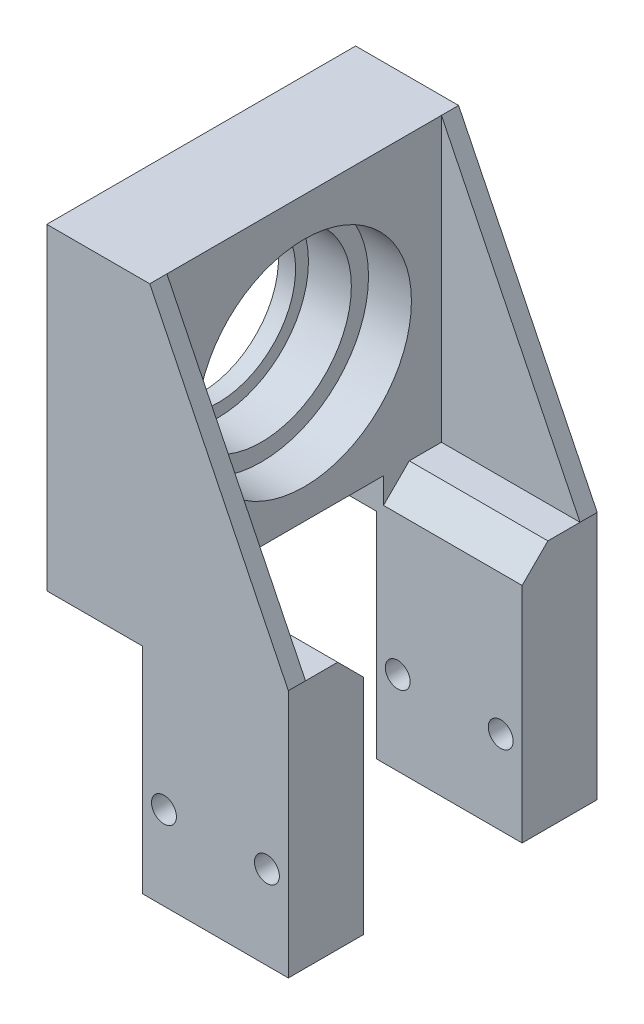
from build123d import *

# Parameters (mm, degrees)
BOSS_EXTRUDE1_DEPTH    = 36
SKETCH2_R              = 10.5
CUT_EXTRUDE1_DEPTH     = 74.491730036
SKETCH3_W              = 18.5
SKETCH3_H              = 29
CUT_EXTRUDE2_DEPTH     = 78.024618067
RIB1_REACH             = 75.682
SKETCH4_WALL_W         = 186.1063102
SKETCH4_WALL_H         = 2
RIB2_REACH             = 75.682
SKETCH5_WALL_W         = 186.1063102
SKETCH5_WALL_H         = 2
CHAMFER1_SIZE          = 3
BOSS_EXTRUDE2_START    = -2
SKETCH6_R              = 10.5
SKETCH6_R_2            = 9
BOSS_EXTRUDE2_DEPTH    = 2
M2_5_CLEARANCE_HOLE1_D = 2.9
SKETCH10_R             = 15
SKETCH10_R_2           = 11
CUT_EXTRUDE4_DEPTH     = 0.6
SKETCH11_R             = 12.5
CUT_EXTRUDE5_DEPTH     = 5


with BuildPart() as part:
    # Sketch1 → Boss-Extrude1 (new body)
    with BuildSketch(Plane.XY):
        Polygon((0, 0), (17, 0), (17, 29), (0.843441467, 29), (0.843441467, 62), (-11.156558533, 62), (-11.156558533, 25), (0, 25), align=None)
    extrude(amount=BOSS_EXTRUDE1_DEPTH)

    # Sketch2 → Cut-Extrude1 (cut, through all)
    with BuildSketch(Plane(origin=(0.843441467, 0, 0), x_dir=(0, 0, -1), z_dir=(1, 0, 0))):
        with Locations((-18, 45)):
            Circle(SKETCH2_R)
    extrude(amount=-CUT_EXTRUDE1_DEPTH, mode=Mode.SUBTRACT)

    # Sketch3 → Cut-Extrude2 (cut, through all)
    with BuildSketch(Plane(origin=(17, 0, 0), x_dir=(0, 0, -1), z_dir=(1, 0, 0))):
        with Locations((-18, 14.5)):
            Rectangle(SKETCH3_W, SKETCH3_H)
    extrude(amount=-CUT_EXTRUDE2_DEPTH, mode=Mode.SUBTRACT)

    # Sketch4 wall → Rib1 (add, up to next)
    with BuildSketch(Plane(origin=(8.921720734, 45.5, 36), x_dir=(0.439720227065, -0.898134801636, 0), z_dir=(0.898134801636, 0.439720227065, 0)), mode=Mode.PRIVATE) as rib1_sk1:
        with Locations((0, 1)):
            Rectangle(SKETCH4_WALL_W, SKETCH4_WALL_H)
    rib1_tool1 = extrude(rib1_sk1.sketch, amount=-RIB1_REACH, mode=Mode.PRIVATE) - part.part
    add(rib1_tool1.solids().sort_by_distance((8.921720734, 45.5, 36))[0])

    # Sketch5 wall → Rib2 (add, up to next)
    with BuildSketch(Plane(origin=(8.921720734, 45.5, 0), x_dir=(0.439720227065, -0.898134801636, 0), z_dir=(-0.898134801636, -0.439720227065, 0)), mode=Mode.PRIVATE) as rib2_sk1:
        with Locations((0, 1)):
            Rectangle(SKETCH5_WALL_W, SKETCH5_WALL_H)
    rib2_tool1 = extrude(rib2_sk1.sketch, amount=RIB2_REACH, mode=Mode.PRIVATE) - part.part
    add(rib2_tool1.solids().sort_by_distance((8.921720734, 45.5, 0))[0])

    # Chamfer1
    chamfer1_edges = [part.edges().sort_by_distance(p)[0] for p in [
        (8.921720733, 29, 27.25),
        (8.921720733, 29, 8.75),
    ]]
    chamfer(chamfer1_edges, length=CHAMFER1_SIZE)

    # Sketch6 → Boss-Extrude2 (add)
    with BuildSketch(Plane.ZY.offset(11.156558533).offset(BOSS_EXTRUDE2_START)):
        with Locations((18, 45)):
            Circle(SKETCH6_R)
        with Locations((18, 45)):
            Circle(SKETCH6_R_2, mode=Mode.SUBTRACT)
    extrude(amount=BOSS_EXTRUDE2_DEPTH)

    # M2.5 Clearance Hole1 (through all)
    with Locations(Plane.XY.offset(36)):
        with Locations((2.5, 9.75), (14.5, 9.75)):
            Hole(M2_5_CLEARANCE_HOLE1_D / 2)

    # Sketch10 → Cut-Extrude4 (cut)
    with BuildSketch(Plane.ZY.offset(11.156558533)):
        with Locations((18, 45)):
            Circle(SKETCH10_R)
        with Locations((18, 45)):
            Circle(SKETCH10_R_2, mode=Mode.SUBTRACT)
    extrude(amount=-CUT_EXTRUDE4_DEPTH, mode=Mode.SUBTRACT)

    # Sketch11 → Cut-Extrude5 (cut)
    with BuildSketch(Plane(origin=(0.843441467, 0, 0), x_dir=(0, 0, -1), z_dir=(1, 0, 0))):
        with Locations((-18, 45)):
            Circle(SKETCH11_R)
    extrude(amount=-CUT_EXTRUDE5_DEPTH, mode=Mode.SUBTRACT)


solid = part.part
